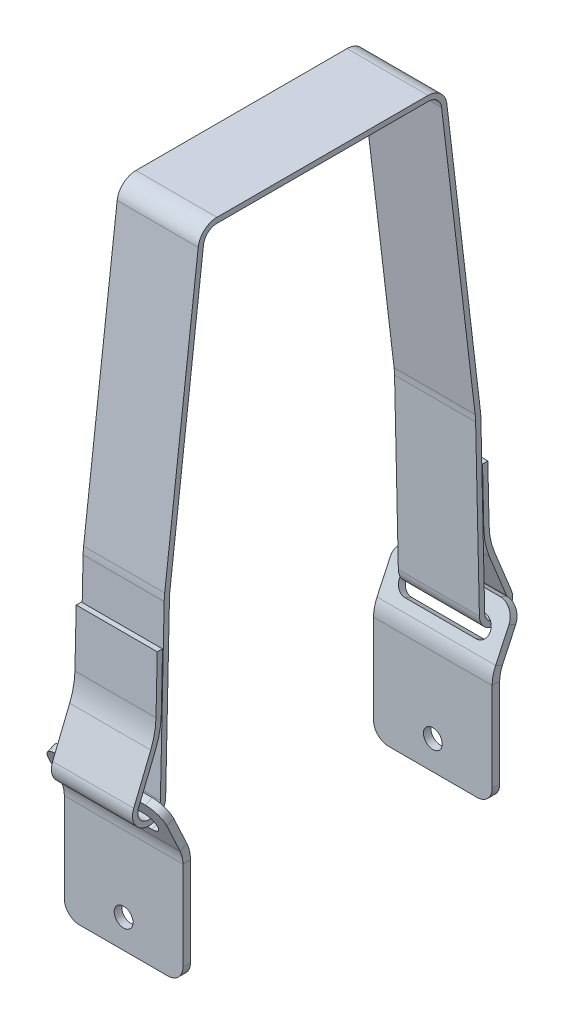
from build123d import *

# Parameters (mm, degrees)
SKETCH1_W              = 39.934289188
SKETCH1_H              = 55.751858455
SKETCH1_R              = 3.175
BOSS_EXTRUDE1_DEPTH    = 2.54
FILLET1_R              = 5.08
SKETCHED_START         = 13.211024663
SKETCHED_BEND1_DEPTH   = 6.788975337
SKETCHED_START_2       = -19.967144594
SKETCHED_BEND1_2_DEPTH = 39.934289188
SKETCHED_START_3       = -14.887144594
SKETCHED_BEND1_3_DEPTH = 29.774289188
SKETCHED_START_4       = 15.340595558
SKETCHED_BEND1_4_DEPTH = 4.626549036
SKETCHED_BEND1_5_DEPTH = 4.626548936
SKETCHED_START_5       = -16.083135627
SKETCHED_BEND1_6_DEPTH = 31.94743135
SKETCHED_START_6       = 9.387948772
SKETCHED_BEND1_7_DEPTH = 2.54
EXTRUDE_THIN3_DEPTH    = 13.6525


with BuildPart() as part:
    # Sketch1 → Boss-Extrude1 (new body)
    with BuildSketch(Plane.XY):
        with Locations((0, 18.166848245)):
            Rectangle(SKETCH1_W, SKETCH1_H)
        Circle(SKETCH1_R, mode=Mode.SUBTRACT)
        with BuildLine():
            Line((-11.946779197, 40.530159664), (11.946779197, 40.530159664))
            ThreePointArc((11.946779197, 40.530159664), (15.340595558, 37.136343303), (11.946779197, 33.742526942))
            Line((11.946779197, 33.742526942), (-11.946779197, 33.742526942))
            ThreePointArc((-11.946779197, 33.742526942), (-15.340595558, 37.136343303), (-11.946779197, 40.530159664))
        make_face(mode=Mode.SUBTRACT)
    extrude(amount=BOSS_EXTRUDE1_DEPTH)

    # Fillet1
    fillet1_edges = [part.edges().sort_by_distance(p)[0] for p in [
        (-19.967144594, 46.042777472, 1.27),
        (19.967144594, 46.042777472, 1.27),
        (19.967144594, -9.709080983, 1.27),
        (-19.967144594, -9.709080983, 1.27),
    ]]
    fillet(fillet1_edges, radius=FILLET1_R)

    # Sketched Bend1: read off the stored shape, not the designer's step
    # Sketched Bend1 outline → Sketched Bend1 (cut)
    with BuildSketch(Plane(origin=(0, 0, 0), x_dir=(1, 0, 0), z_dir=(0, 0.4226182617407011, -0.9063077870366493)).offset(SKETCHED_START)):
        with BuildLine():
            Line((-11.946779197, -38.528434057), (11.946779197, -38.528434057))
            ThreePointArc((11.946779197, -38.528434057), (15.340595558, -35.134617696), (11.946779197, -31.740801335))
            Line((11.946779197, -31.740801335), (-11.946779197, -31.740801335))
            ThreePointArc((-11.946779197, -31.740801335), (-15.340595558, -35.134617696), (-11.946779197, -38.528434057))
        make_face()
    extrude(amount=SKETCHED_BEND1_DEPTH, mode=Mode.SUBTRACT)

    # Sketched Bend1 2 outline → Sketched Bend1 2 (cut)
    with BuildSketch(Plane.YZ.offset(SKETCHED_START_2)):
        with BuildLine():
            Line((33.670978847, 2.54), (30.743513202, 1.174900351))
            ThreePointArc((30.743513202, 1.174900351), (28.158032959, 0.297248071), (25.4438802, 0))
            Line((25.4438802, 0), (46.042777472, 0))
            Line((46.042777472, 0), (46.042777472, 2.54))
            Line((46.042777472, 2.54), (33.670978847, 2.54))
        make_face()
    extrude(amount=SKETCHED_BEND1_2_DEPTH, mode=Mode.SUBTRACT)

    # Sketched Bend1 3 outline → Sketched Bend1 3 (add)
    with BuildSketch(Plane.YZ.offset(SKETCHED_START_3)):
        with BuildLine():
            Line((32.734454008, 4.90587121), (29.670062817, 3.47692213))
            ThreePointArc((29.670062817, 3.47692213), (27.608276339, 2.777039929), (25.4438802, 2.54))
            Line((25.4438802, 2.54), (33.670978847, 2.54))
            Line((33.670978847, 2.54), (33.807904393, 2.603849431))
            Line((33.807904393, 2.603849431), (32.734454008, 4.90587121))
        make_face()
        Polygon((43.882266846, 10.104181707), (38.886138399, 7.774448751), (39.959588784, 5.472426973), (44.95571723, 7.802159928), align=None)
    extrude(amount=SKETCHED_BEND1_3_DEPTH)

    # Sketched Bend1 4 outline → Sketched Bend1 4 (add)
    with BuildSketch(Plane.YZ.offset(SKETCHED_START_4)):
        with BuildLine():
            ThreePointArc((29.670062817, 3.47692213), (27.608276339, 2.777039929), (25.4438802, 2.54))
            Line((25.4438802, 2.54), (33.670978847, 2.54))
            Line((33.670978847, 2.54), (39.959588784, 5.472426973))
            Line((39.959588784, 5.472426973), (38.886138399, 7.774448752))
            Line((38.886138399, 7.774448752), (29.670062817, 3.47692213))
        make_face()
    extrude(amount=SKETCHED_BEND1_4_DEPTH)

    # Sketched Bend1 5 outline → Sketched Bend1 5 (add)
    with BuildSketch(Plane.YZ.offset(SKETCHED_START_2)):
        with BuildLine():
            ThreePointArc((29.670062817, 3.47692213), (27.608276339, 2.777039929), (25.4438802, 2.54))
            Line((25.4438802, 2.54), (33.670978847, 2.54))
            Line((33.670978847, 2.54), (39.959588784, 5.472426973))
            Line((39.959588784, 5.472426973), (38.886138399, 7.774448752))
            Line((38.886138399, 7.774448752), (29.670062817, 3.47692213))
        make_face()
    extrude(amount=SKETCHED_BEND1_5_DEPTH)

    # Sketched Bend1 6 outline → Sketched Bend1 6 (add)
    with BuildSketch(Plane.YZ.offset(SKETCHED_START_5)):
        with BuildLine():
            Line((32.734454008, 4.90587121), (29.670062817, 3.47692213))
            ThreePointArc((29.670062817, 3.47692213), (27.608276339, 2.777039929), (25.4438802, 2.54))
            Line((25.4438802, 2.54), (33.670978847, 2.54))
            Line((33.670978847, 2.54), (33.807904393, 2.603849431))
            Line((33.807904393, 2.603849431), (32.734454008, 4.90587121))
        make_face()
    extrude(amount=SKETCHED_BEND1_6_DEPTH)

    # Sketched Bend1 7 outline → Sketched Bend1 7 (add)
    with BuildSketch(Plane(origin=(0, 0, 0), x_dir=(1, 0, 0), z_dir=(0, 0.4226182617407011, -0.9063077870366493)).offset(SKETCHED_START_6)):
        with BuildLine():
            ThreePointArc((15.340595558, -35.134617696), (14.34656976, -37.534408259), (11.946779197, -38.528434057))
            Line((11.946779197, -38.528434057), (14.887144594, -38.528434056))
            Line((14.887144594, -38.528434056), (14.887144594, -44.041051864))
            ThreePointArc((14.887144594, -44.041051864), (18.479247043, -42.553154312), (19.967144594, -38.961051864))
            Line((19.967144594, -38.961051864), (19.967144594, -38.528434057))
            Line((19.967144594, -38.528434057), (15.340595558, -38.528434057))
            Line((15.340595558, -38.528434057), (15.340595558, -35.134617696))
        make_face()
        with BuildLine():
            ThreePointArc((11.946779197, -31.740801335), (14.34656976, -32.734827133), (15.340595558, -35.134617696))
            Line((15.340595558, -35.134617696), (15.340595558, -31.740801335))
            Line((15.340595558, -31.740801335), (11.946779197, -31.740801335))
        make_face()
        with BuildLine():
            Line((-14.887144594, -38.528434056), (-11.946779197, -38.528434057))
            ThreePointArc((-11.946779197, -38.528434057), (-14.34656976, -37.534408259), (-15.340595558, -35.134617696))
            Line((-15.340595558, -35.134617696), (-15.340595658, -38.528434057))
            Line((-15.340595658, -38.528434057), (-19.967144594, -38.528434057))
            Line((-19.967144594, -38.528434057), (-19.967144594, -38.961051864))
            ThreePointArc((-19.967144594, -38.961051864), (-18.479247043, -42.553154312), (-14.887144594, -44.041051864))
            Line((-14.887144594, -44.041051864), (-14.887144594, -38.528434056))
        make_face()
        with BuildLine():
            Line((-15.340595658, -31.740801335), (-15.340595558, -35.134617696))
            ThreePointArc((-15.340595558, -35.134617696), (-14.34656976, -32.734827133), (-11.946779197, -31.740801335))
            Line((-11.946779197, -31.740801335), (-15.340595658, -31.740801335))
        make_face()
    extrude(amount=SKETCHED_BEND1_7_DEPTH)


with BuildPart() as body_2:
    # Mirror1: mirrored copy
    add(part.part.mirror(Plane(origin=(0, 0, -50.8), x_dir=(1, 0, 0), z_dir=(0, 0, -1))))


with BuildPart() as body_3:
    # Sketch10 → Extrude-Thin3 (new, symmetric)
    with BuildSketch(Plane(origin=(0, 0, 0), x_dir=(0, 0, -1), z_dir=(1, 0, 0))):
        with BuildLine():
            Line((104.688774774, 85.347872367), (105.113038889, 66.297872367))
            ThreePointArc((105.113038889, 66.297872367), (105.643116213, 61.638035226), (107.007856334, 57.151104365))
            Line((107.007856334, 57.151104365), (112.749284639, 43.033965808))
            ThreePointArc((112.749284639, 43.033965808), (109.992859285, 37.867819469), (105.410944531, 41.513776945))
            Line((105.410944531, 41.513776945), (104.133703128, 98.863545249))
            ThreePointArc((104.133703128, 98.863545249), (104.077414719, 100.079969515), (103.962889985, 101.292298045))
            Line((103.962889985, 101.292298045), (92.665722496, 196.455574511))
            ThreePointArc((92.665722496, 196.455574511), (90.57717037, 200.454417622), (86.36, 202.057))
            Line((86.36, 202.057), (15.24, 202.057))
            ThreePointArc((15.24, 202.057), (11.02282963, 200.454417622), (8.934277504, 196.455574511))
            Line((8.934277504, 196.455574511), (-2.362889985, 101.292298045))
            ThreePointArc((-2.362889985, 101.292298045), (-2.477414719, 100.079969515), (-2.533703128, 98.863545249))
            Line((-2.533703128, 98.863545249), (-3.810944531, 41.513776945))
            ThreePointArc((-3.810944531, 41.513776945), (-8.392859285, 37.867819469), (-11.149284639, 43.033965808))
            Line((-11.149284639, 43.033965808), (-5.407856334, 57.151104365))
            ThreePointArc((-5.407856334, 57.151104365), (-4.043116213, 61.638035226), (-3.513038889, 66.297872367))
            Line((-3.513038889, 66.297872367), (-3.088774774, 85.347872367))
            Line((-3.088774774, 85.347872367), (-4.866333993, 85.387460534))
            Line((-4.866333993, 85.387460534), (-5.290598108, 66.337460534))
            ThreePointArc((-5.290598108, 66.337460534), (-5.784151202, 61.998702892), (-7.054855833, 57.820937667))
            Line((-7.054855833, 57.820937667), (-12.796284137, 43.703799111))
            ThreePointArc((-12.796284137, 43.703799111), (-8.753526951, 36.12678448), (-2.033385312, 41.474188777))
            Line((-2.033385312, 41.474188777), (-0.756143909, 98.823957082))
            ThreePointArc((-0.756143909, 98.823957082), (-0.703795689, 99.955231649), (-0.597287686, 101.082697182))
            Line((-0.597287686, 101.082697182), (10.699879803, 196.245973648))
            ThreePointArc((10.699879803, 196.245973648), (12.203637334, 199.125140688), (15.24, 200.279))
            Line((15.24, 200.279), (86.36, 200.279))
            ThreePointArc((86.36, 200.279), (89.396362666, 199.125140688), (90.900120197, 196.245973648))
            Line((90.900120197, 196.245973648), (102.197287686, 101.082697182))
            ThreePointArc((102.197287686, 101.082697182), (102.303795689, 99.955231649), (102.356143909, 98.823957082))
            Line((102.356143909, 98.823957082), (103.633385312, 41.474188777))
            ThreePointArc((103.633385312, 41.474188777), (110.353526951, 36.12678448), (114.396284137, 43.703799111))
            Line((114.396284137, 43.703799111), (108.654855833, 57.820937667))
            ThreePointArc((108.654855833, 57.820937667), (107.384151202, 61.998702892), (106.890598108, 66.337460534))
            Line((106.890598108, 66.337460534), (106.466333993, 85.387460534))
            Line((106.466333993, 85.387460534), (104.688774774, 85.347872367))
        make_face()
    extrude(amount=EXTRUDE_THIN3_DEPTH, both=True)


solid = Compound([part.part, body_2.part, body_3.part])
